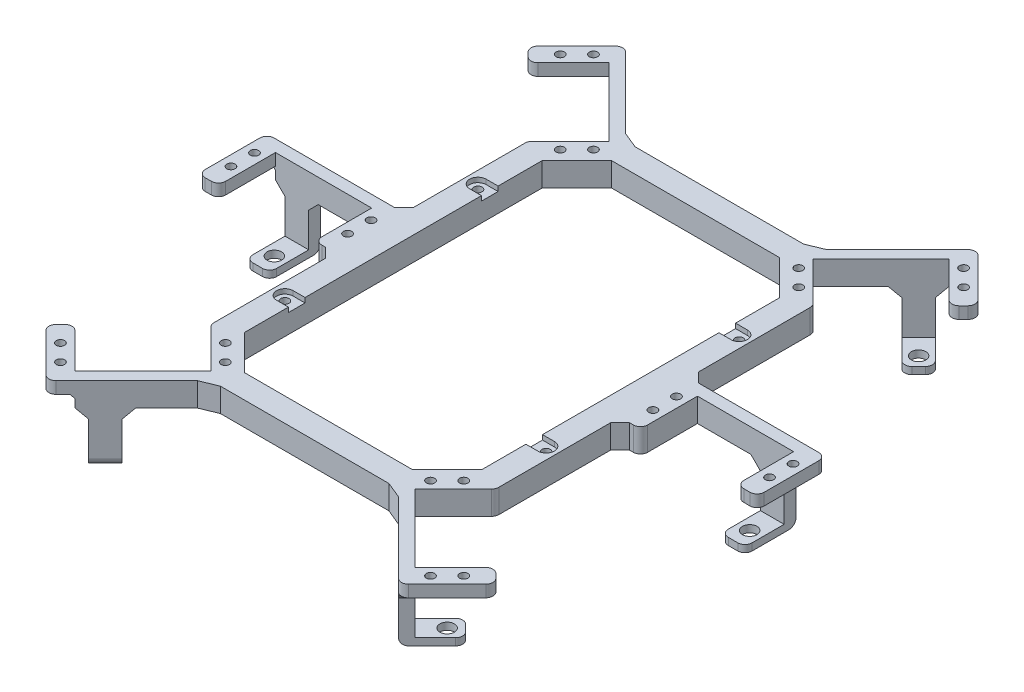
from build123d import *

# Parameters (mm, degrees)
BOSS_EXTRUDE1_DEPTH = 10
BOSS_EXTRUDE2_DEPTH = 10
SKETCH2_R           = 1.75
CUT_EXTRUDE1_DEPTH  = 170.836253253
SKETCH26_W          = 8.6
SKETCH26_H          = 29
CUT_EXTRUDE7_DEPTH  = 5
SKETCH5_W           = 10
SKETCH5_H           = 5
BOSS_EXTRUDE3_DEPTH = 21.5
SKETCH6_W           = 10
SKETCH6_H           = 3
BOSS_EXTRUDE4_DEPTH = 15
SKETCH19_W          = 10
SKETCH19_H          = 3
BOSS_EXTRUDE9_DEPTH = 16.5
SKETCH7_R           = 3.05
CUT_EXTRUDE2_DEPTH  = 3
SKETCH20_R          = 3.05
CUT_EXTRUDE4_DEPTH  = 10
MIRROR4_START       = -21.5
MIRROR4_DEPTH       = 21.5
MIRROR4_2_OUTLINE_R = 3.05
MIRROR4_2_DEPTH     = 3
CUT_EXTRUDE5_DEPTH  = 2
SKETCH24_R          = 1.75
CUT_EXTRUDE6_DEPTH  = 173.088938979
CHAMFER4_SIZE       = 4
FILLET1_R           = 3
CHAMFER1_SIZE       = 4
CHAMFER3_SIZE       = 1.5


# Read off the part's stored shape, not the designer's step: Mirror4
with BuildPart() as part:
    # Sketch1 → Boss-Extrude1 (new body)
    with BuildSketch(Plane(origin=(0, 0, 0), x_dir=(1, 0, 0), z_dir=(0, 1, 0))):
        Polygon((0, 87.31), (39.493903346, 87.31), (60, 66.803903346), (60, 14.5), (68.6, 14.5), (68.6, -14.5), (60, -14.5), (60, -66.803903346), (39.493903346, -87.31), (0, -87.31), (0, -77.31), (35.351767722, -77.31), (50, -62.661767722), (50, 62.661767722), (35.351767722, 77.31), (0, 77.31), align=None)
    extrude(amount=BOSS_EXTRUDE1_DEPTH)

    # Sketch4 → Boss-Extrude2 (add)
    with BuildSketch(Plane.XZ):
        Polygon((39.493903346, -87.31), (74.212846302, -122.028942956), (94.718942956, -101.522846302), (88.637824638, -95.441727984), (71.66726189, -112.412290732), (43.029437252, -83.774466094), align=None)
        Polygon((68.6, -9.5), (109.1, -9.5), (109.1, 14.5), (117.7, 14.5), (117.7, -14.5), (68.6, -14.5), align=None)
        Polygon((71.66726189, 112.412290732), (43.029437252, 83.774466094), (39.493903346, 87.31), (74.212846302, 122.028942956), (94.718942956, 101.522846302), (88.637824638, 95.441727984), align=None)
    extrude(amount=-BOSS_EXTRUDE2_DEPTH)

    # Sketch2 → Cut-Extrude1 (cut, through all)
    with BuildSketch(Plane(origin=(0, 10, 0), x_dir=(1, 0, 0), z_dir=(0, 1, 0))):
        with Locations(Location((64.3, 4.95, 0), (0, 0, 270))):
            Circle(SKETCH2_R)
        with Locations(Location((43.206213947, 77.516571081, 0), (0, 0, 270))):
            Circle(SKETCH2_R)
        with Locations(Location((50.206571081, 70.516213947, 0), (0, 0, 90))):
            Circle(SKETCH2_R)
        with Locations(Location((84.925514037, 105.235156903, 0), (0, 0, 270))):
            Circle(SKETCH2_R)
        with Locations(Location((77.925156903, 112.235514037, 0), (0, 0, 90))):
            Circle(SKETCH2_R)
        with Locations(Location((64.3, -4.95, 0), (0, 0, 90))):
            Circle(SKETCH2_R)
        with Locations(Location((113.4, -4.95, 0), (0, 0, 270))):
            Circle(SKETCH2_R)
        with Locations(Location((113.4, 4.95, 0), (0, 0, 90))):
            Circle(SKETCH2_R)
        with Locations(Location((84.925514037, -105.235156903, 0), (0, 0, 90))):
            Circle(SKETCH2_R)
        with Locations(Location((77.925156903, -112.235514037, 0), (0, 0, 270))):
            Circle(SKETCH2_R)
        with Locations(Location((50.206571081, -70.516213947, 0), (0, 0, 270))):
            Circle(SKETCH2_R)
        with Locations(Location((43.206213947, -77.516571081, 0), (0, 0, 90))):
            Circle(SKETCH2_R)
    extrude(amount=-CUT_EXTRUDE1_DEPTH, mode=Mode.SUBTRACT)

    # Sketch26 → Cut-Extrude7 (cut)
    with BuildSketch(Plane.XZ):
        with Locations((113.4, 0)):
            Rectangle(SKETCH26_W, SKETCH26_H)
        Polygon((74.212846302, 122.028942956), (94.718942956, 101.522846302), (88.637824638, 95.441727984), (68.131727984, 115.947824638), align=None)
        Polygon((88.637824638, -95.441727984), (68.131727984, -115.947824638), (74.212846302, -122.028942956), (94.718942956, -101.522846302), align=None)
    extrude(amount=-CUT_EXTRUDE7_DEPTH, mode=Mode.SUBTRACT)

    # Sketch5 → Boss-Extrude3 (add)
    with BuildSketch(Plane.XZ):
        Polygon((58.175664505, -105.991761159), (61.71119841, -102.456227253), (68.782266222, -109.527295065), (65.246732316, -113.062828971), align=None)
        with Locations((100.1, -12)):
            Rectangle(SKETCH5_W, SKETCH5_H)
    extrude(amount=BOSS_EXTRUDE3_DEPTH)

    # Sketch6 → Boss-Extrude4 (add)
    with BuildSketch(Plane(origin=(-20.372514421, 0, -20.372514421), x_dir=(0.7071067811865475, 0, -0.7071067811865477), z_dir=(0.7071067811865477, 0, 0.7071067811865475))):
        with Locations((121.083899937, -20)):
            Rectangle(SKETCH6_W, SKETCH6_H)
    extrude(amount=BOSS_EXTRUDE4_DEPTH)

    # Sketch19 → Boss-Extrude9 (add)
    with BuildSketch(Plane.XY.offset(-9.5)):
        with Locations((100.1, -20)):
            Rectangle(SKETCH19_W, SKETCH19_H)
    extrude(amount=BOSS_EXTRUDE9_DEPTH)

    # Sketch7 → Cut-Extrude2 (cut)
    with BuildSketch(Plane(origin=(0, -18.5, 0), x_dir=(1, 0, 0), z_dir=(0, 1, 0))):
        with Locations(Location((71.964246738, 99.274246738, 0), (0, 0, 270))):
            Circle(SKETCH7_R)
    extrude(amount=-CUT_EXTRUDE2_DEPTH, mode=Mode.SUBTRACT)

    # Sketch20 → Cut-Extrude4 (cut)
    with BuildSketch(Plane(origin=(0, -18.5, 0), x_dir=(1, 0, 0), z_dir=(0, 1, 0))):
        with Locations(Location((100.1, 0, 0), (0, 0, 270))):
            Circle(SKETCH20_R)
    extrude(amount=-CUT_EXTRUDE4_DEPTH, mode=Mode.SUBTRACT)

    # Mirror4 outline → Mirror4 (add)
    with BuildSketch(Plane(origin=(0, 0, 0), x_dir=(1, 0, 0), z_dir=(0, 1, 0)).offset(MIRROR4_START)):
        Polygon((61.711198411, -102.456227253), (58.175664505, -105.991761159), (65.246732317, -113.062828971), (68.782266222, -109.527295064), align=None)
    extrude(amount=MIRROR4_DEPTH)

    # Mirror4 2 outline → Mirror4 2 (add)
    with BuildSketch(Plane(origin=(0, 0, 0), x_dir=(1, 0, 0), z_dir=(0, 1, 0)).offset(MIRROR4_START)):
        Polygon((72.317800128, -91.849625535), (61.711198411, -102.456227253), (68.782266222, -109.527295064), (79.38886794, -98.920693347), align=None)
        with Locations((71.964246738, -99.274246738)):
            Circle(MIRROR4_2_OUTLINE_R, mode=Mode.SUBTRACT)
    extrude(amount=MIRROR4_2_DEPTH)

    # Sketch21 → Cut-Extrude5 (cut)
    with BuildSketch(Plane(origin=(0, 10, 0), x_dir=(1, 0, 0), z_dir=(0, 1, 0))):
        with BuildLine():
            Line((55, 44.151951673), (50, 44.151951673))
            Line((50, 44.151951673), (50, 37.151951673))
            Line((50, 37.151951673), (55, 37.151951673))
            ThreePointArc((55, 37.151951673), (58.5, 40.651951673), (55, 44.151951673))
        make_face()
        with BuildLine():
            Line((50, -37.151951673), (55, -37.151951673))
            ThreePointArc((55, -37.151951673), (58.5, -40.651951673), (55, -44.151951673))
            Line((55, -44.151951673), (50, -44.151951673))
            Line((50, -44.151951673), (50, -37.151951673))
        make_face()
    extrude(amount=-CUT_EXTRUDE5_DEPTH, mode=Mode.SUBTRACT)

    # Sketch24 → Cut-Extrude6 (cut, through all)
    with BuildSketch(Plane(origin=(0, 8, 0), x_dir=(1, 0, 0), z_dir=(0, 1, 0))):
        with Locations(Location((55, 40.651951673, 0), (0, 0, 270))):
            Circle(SKETCH24_R)
        with Locations(Location((55, -40.651951673, 0), (0, 0, 270))):
            Circle(SKETCH24_R)
    extrude(amount=-CUT_EXTRUDE6_DEPTH, mode=Mode.SUBTRACT)

    # Chamfer4
    chamfer4_edges = [part.edges().sort_by_distance(p)[0] for p in [
        (39.493903346, 5, -87.31),
        (39.493903346, 5, 87.31),
    ]]
    chamfer(chamfer4_edges, length=CHAMFER4_SIZE)

    # Fillet1
    fillet1_edges = [part.edges().sort_by_distance(p)[0] for p in [
        (61.71119841, -21.5, -109.527295065),
        (100.1, -21.5, -14.5),
        (79.38886794, -20, -98.920693347),
        (72.317800128, -20, -91.849625535),
        (95.1, -20, 7),
        (105.1, -20, 7),
        (60, 5, -66.803903346),
        (68.6, 5, 14.5),
        (60, 5, 66.803903346),
        (61.711198411, -21.5, 109.527295065),
        (72.317800128, -20, 91.849625535),
        (79.38886794, -20, 98.920693347),
        (74.212846302, 7.5, -122.028942956),
        (94.718942956, 7.5, -101.522846302),
        (88.637824638, 7.5, -95.441727984),
        (117.7, 7.5, -14.5),
        (117.7, 7.5, 14.5),
        (109.1, 7.5, 14.5),
        (94.718942956, 7.5, 101.522846302),
        (74.212846302, 7.5, 122.028942956),
        (88.637824638, 7.5, 95.441727984),
    ]]
    fillet(fillet1_edges, radius=FILLET1_R)

    # Chamfer1
    chamfer1_edges = [part.edges().sort_by_distance(p)[0] for p in [
        (67.014499269, 0, -111.295062018),
        (59.943431458, 0, -104.223994206),
        (95.1, 0, -12),
        (105.1, 0, -12),
        (60, 5, -14.5),
        (60, 5, 14.5),
        (67.014499269, 0, 111.295062018),
        (59.943431458, 0, 104.223994206),
    ]]
    chamfer(chamfer1_edges, length=CHAMFER1_SIZE - 0.0001)  # a hair under: the kernel refuses the full size

    # Chamfer3
    chamfer3_edges = [part.edges().sort_by_distance(p)[0] for p in [
        (109.1, 5, -12),
        (69.899494937, 5, 114.180057685),
        (69.899494937, 5, -114.180057685),
    ]]
    chamfer(chamfer3_edges, length=CHAMFER3_SIZE)

    # Mirror3: part across plane


with BuildPart() as part_1:
    add(part.part)
    add(part.part.mirror(Plane(origin=(0, 10, -87.31), x_dir=(0, 0, 1), z_dir=(1, 0, 0))))


solid = part_1.part
